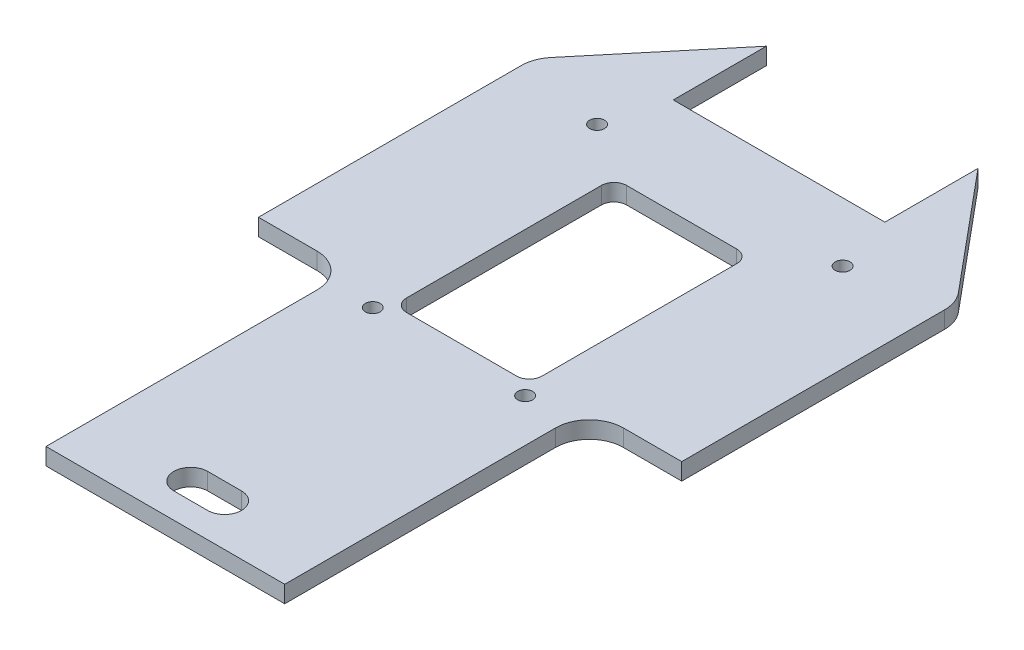
from build123d import *

# Parameters (mm, degrees)
SKETCH1_R           = 1.75
BOSS_EXTRUDE1_DEPTH = 4


with BuildPart() as part:
    # Sketch1 → Boss-Extrude1 (new body)
    with BuildSketch(Plane(origin=(0, 0, 0), x_dir=(1, 0, 0), z_dir=(0, 1, 0))):
        with BuildLine():
            Line((-28.2, -67), (28.2, -67))
            Line((28.2, -67), (28.2, -3))
            ThreePointArc((28.2, -3), (30.543145751, 2.656854249), (36.2, 5))
            Line((36.2, 5), (50, 5))
            Line((50, 5), (50, 67.103600519))
            ThreePointArc((50, 67.103600519), (49.522172621, 69.827002629), (48.145770237, 72.225075716))
            Line((48.145770237, 72.225075716), (25, 100))
            Line((25, 100), (25, 78))
            Line((25, 78), (-25, 78))
            Line((-25, 78), (-25, 100))
            Line((-25, 100), (-48.145770237, 72.225075716))
            ThreePointArc((-48.145770237, 72.225075716), (-49.522172621, 69.827002629), (-50, 67.103600519))
            Line((-50, 67.103600519), (-50, 5))
            Line((-50, 5), (-36.2, 5))
            ThreePointArc((-36.2, 5), (-30.543145751, 2.656854249), (-28.2, -3))
            Line((-28.2, -3), (-28.2, -67))
        make_face()
        with Locations((18, 0)):
            Circle(SKETCH1_R, mode=Mode.SUBTRACT)
        with Locations((-18, 0)):
            Circle(SKETCH1_R, mode=Mode.SUBTRACT)
        with Locations((29, 64)):
            Circle(SKETCH1_R, mode=Mode.SUBTRACT)
        with Locations((-29, 64)):
            Circle(SKETCH1_R, mode=Mode.SUBTRACT)
        with BuildLine():
            Line((-13, 3), (13, 3))
            ThreePointArc((13, 3), (15.121320344, 3.878679656), (16, 6))
            Line((16, 6), (16, 52))
            ThreePointArc((16, 52), (15.121320344, 54.121320344), (13, 55))
            Line((13, 55), (-13, 55))
            ThreePointArc((-13, 55), (-15.121320344, 54.121320344), (-16, 52))
            Line((-16, 52), (-16, 6))
            ThreePointArc((-16, 6), (-15.121320344, 3.878679656), (-13, 3))
        make_face(mode=Mode.SUBTRACT)
        with BuildLine():
            Line((-4, -53), (4, -53))
            ThreePointArc((4, -53), (8, -57), (4, -61))
            Line((4, -61), (-4, -61))
            ThreePointArc((-4, -61), (-8, -57), (-4, -53))
        make_face(mode=Mode.SUBTRACT)
    extrude(amount=BOSS_EXTRUDE1_DEPTH)


solid = part.part
